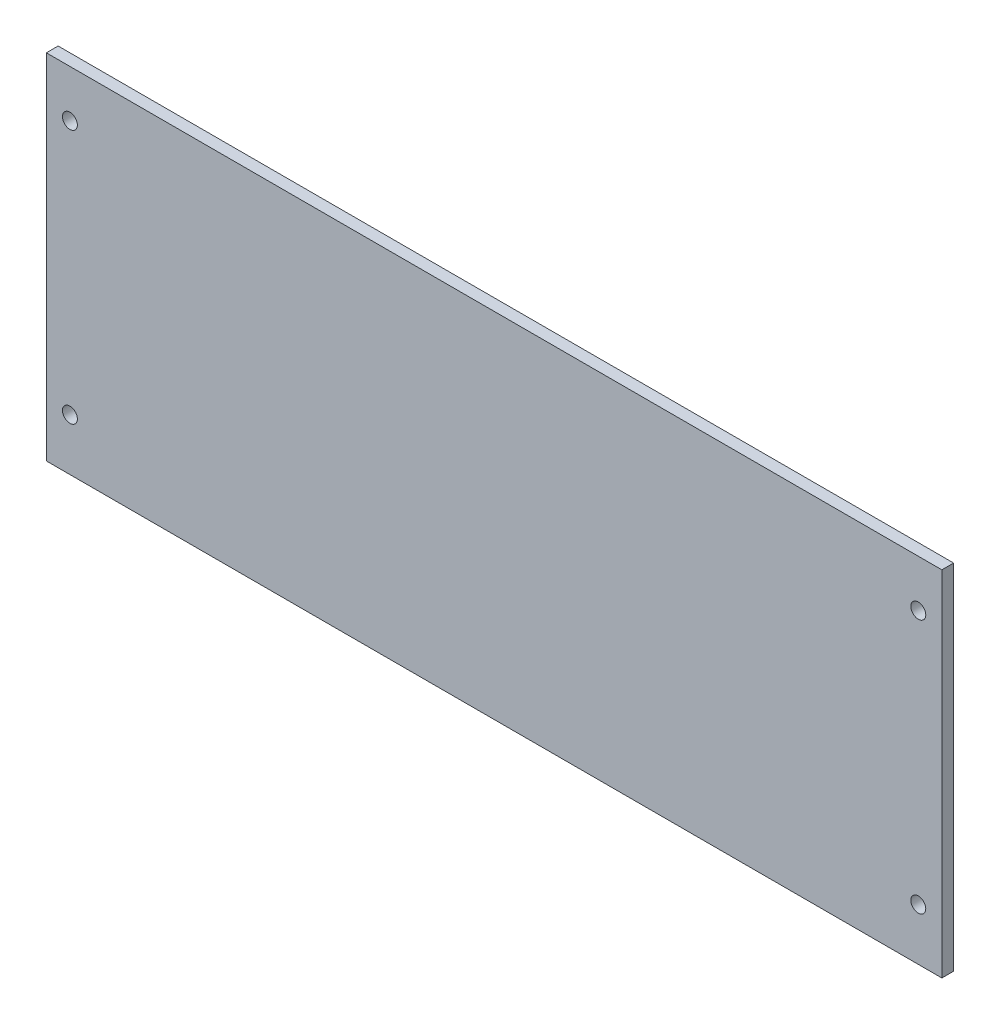
from build123d import *

# Parameters (mm, degrees)
SKETCH1_W           = 190
SKETCH1_H           = 75
SKETCH1_R           = 1.585
BOSS_EXTRUDE1_DEPTH = 2.5


with BuildPart() as part:
    # Sketch1 → Boss-Extrude1 (new body)
    with BuildSketch(Plane.XY):
        with Locations((95, 37.5)):
            Rectangle(SKETCH1_W, SKETCH1_H)
        with Locations((5, 65)):
            Circle(SKETCH1_R, mode=Mode.SUBTRACT)
        with Locations((185, 65)):
            Circle(SKETCH1_R, mode=Mode.SUBTRACT)
        with Locations((5, 11)):
            Circle(SKETCH1_R, mode=Mode.SUBTRACT)
        with Locations((185, 11)):
            Circle(SKETCH1_R, mode=Mode.SUBTRACT)
    extrude(amount=BOSS_EXTRUDE1_DEPTH)


solid = part.part
